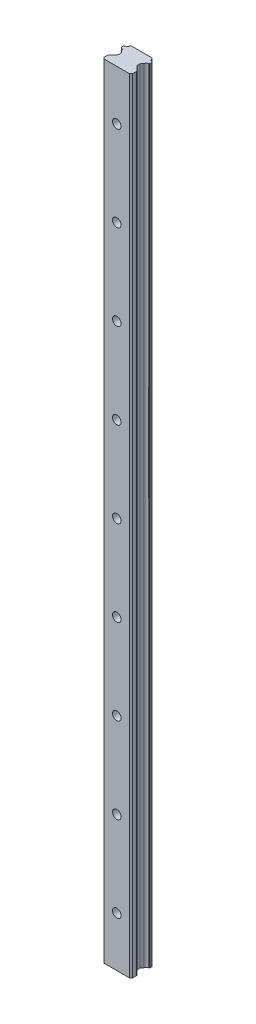
from build123d import *

# Parameters (mm, degrees)
EXTRUDE_1_DEPTH               = 550
SKETCH_80_R                   = 4.75
EXTRUDE_12_DEPTH              = 0.9
PATTERN_START                 = -17.499999985
PATTERN_LINEAR_1_OUTLINE_R    = 4.75
PATTERN_LINEAR_1_DEPTH        = 0.9
PATTERN_LINEAR_1_2_OUTLINE_R  = 4.75
PATTERN_LINEAR_1_2_DEPTH      = 0.9
PATTERN_LINEAR_1_3_OUTLINE_R  = 4.75
PATTERN_LINEAR_1_3_DEPTH      = 0.9
PATTERN_LINEAR_1_4_OUTLINE_R  = 4.75
PATTERN_LINEAR_1_4_DEPTH      = 0.9
PATTERN_LINEAR_1_5_OUTLINE_R  = 4.75
PATTERN_LINEAR_1_5_DEPTH      = 0.9
PATTERN_LINEAR_1_6_OUTLINE_R  = 4.75
PATTERN_LINEAR_1_6_DEPTH      = 0.9
PATTERN_LINEAR_1_7_OUTLINE_R  = 4.75
PATTERN_LINEAR_1_7_DEPTH      = 0.9
PATTERN_LINEAR_1_8_OUTLINE_R  = 4.75
PATTERN_LINEAR_1_8_DEPTH      = 0.9
PATTERN_LINEAR_1_9_OUTLINE_R  = 4.75
PATTERN_LINEAR_1_9_DEPTH      = 8.499999985
PATTERN_START_2               = -9
PATTERN_LINEAR_1_10_OUTLINE_R = 3
PATTERN_LINEAR_1_10_DEPTH     = 9


# Read off the part's stored shape, not the designer's step: Линейный массив1
with BuildPart() as part:
    # Эскиз1 → Бобышка-Вытянуть1 (new body)
    with BuildSketch(Plane(origin=(0, 0, 0), x_dir=(1, 0, 0), z_dir=(0, 1, 0))):
        with BuildLine():
            Line((-10, 3.656507036), (-10, 1))
            Line((-10, 1), (-9, 0))
            Line((-9, 0), (9, 0))
            Line((9, 0), (10, 1))
            Line((10, 1), (10, 3.656507036))
            ThreePointArc((10, 3.656507036), (9.92387953, 4.039190479), (9.707106773, 4.363613837))
            Line((9.707106773, 4.363613837), (6.892893227, 7.177827383))
            ThreePointArc((6.892893227, 7.177827383), (6.67612047, 7.502250741), (6.6, 7.884934184))
            Line((6.6, 7.884934184), (6.6, 9.445065806))
            ThreePointArc((6.6, 9.445065806), (6.67612047, 9.827749249), (6.892893227, 10.152172607))
            Line((6.892893227, 10.152172607), (7.63016236, 10.88944174))
            ThreePointArc((7.63016236, 10.88944174), (7.773916172, 11.035785914), (7.84680643, 11.2275378))
            ThreePointArc((7.84680643, 11.2275378), (8.39638832, 12.26292769), (9.431778202, 12.812509595))
            ThreePointArc((9.431778202, 12.812509595), (9.571493891, 12.861817755), (9.690625709, 12.949905089))
            Line((9.690625709, 12.949905089), (9.85355341, 13.11283279))
            ThreePointArc((9.85355341, 13.11283279), (9.961939771, 13.275044443), (10, 13.466386134))
            Line((10, 13.466386134), (10, 14.523613836))
            ThreePointArc((10, 14.523613836), (9.961939771, 14.714955527), (9.85355341, 14.87716718))
            Line((9.85355341, 14.87716718), (9.678500897, 15.052219693))
            ThreePointArc((9.678500897, 15.052219693), (9.560417661, 15.139748844), (9.421985093, 15.189159641))
            ThreePointArc((9.421985093, 15.189159641), (8.395921978, 15.736919382), (7.84816224, 16.7629825))
            ThreePointArc((7.84816224, 16.7629825), (7.775191486, 16.953000828), (7.632531165, 17.098189425))
            Line((7.632531165, 17.098189425), (7.230720605, 17.499999985))
            Line((7.230720605, 17.499999985), (-7.230720615, 17.499999985))
            Line((-7.230720615, 17.499999985), (-7.632531175, 17.098189425))
            ThreePointArc((-7.632531175, 17.098189425), (-7.775191503, 16.953000832), (-7.84816225, 16.7629825))
            ThreePointArc((-7.84816225, 16.7629825), (-8.395921997, 15.736919373), (-9.421985128, 15.189159636))
            ThreePointArc((-9.421985128, 15.189159636), (-9.560417671, 15.13974885), (-9.678500884, 15.052219716))
            Line((-9.678500884, 15.052219716), (-9.85355341, 14.87716719))
            ThreePointArc((-9.85355341, 14.87716719), (-9.961939771, 14.714955537), (-10, 14.523613846))
            Line((-10, 14.523613846), (-10, 13.466386134))
            ThreePointArc((-10, 13.466386134), (-9.961939771, 13.275044443), (-9.85355341, 13.11283279))
            Line((-9.85355341, 13.11283279), (-9.690625667, 12.949905047))
            ThreePointArc((-9.690625667, 12.949905047), (-9.57149389, 12.861817745), (-9.431778248, 12.812509604))
            ThreePointArc((-9.431778248, 12.812509604), (-8.396388337, 12.262927707), (-7.84680643, 11.2275378))
            ThreePointArc((-7.84680643, 11.2275378), (-7.773916168, 11.035785916), (-7.63016236, 10.88944174))
            Line((-7.63016236, 10.88944174), (-6.892893227, 10.152172607))
            ThreePointArc((-6.892893227, 10.152172607), (-6.67612047, 9.827749249), (-6.6, 9.445065806))
            Line((-6.6, 9.445065806), (-6.6, 7.884934184))
            ThreePointArc((-6.6, 7.884934184), (-6.67612047, 7.502250741), (-6.892893227, 7.177827383))
            Line((-6.892893227, 7.177827383), (-9.707106773, 4.363613837))
            ThreePointArc((-9.707106773, 4.363613837), (-9.92387953, 4.039190479), (-10, 3.656507036))
        make_face()
    extrude(amount=-EXTRUDE_1_DEPTH)

    # Эскиз6 → Вырез-Повернуть1 (revolve, cut)
    with BuildSketch(Plane(origin=(0, 30, 0), x_dir=(0, -1, 0), z_dir=(1, 0, 0)), mode=Mode.PRIVATE) as cut_revolve_1_sk:
        Polygon((60.25, 17.499999985), (65, 17.499999985), (65, 0), (62, 0), (62, 9), (60.25, 9), align=None)
    revolve(cut_revolve_1_sk.sketch.rotate(Axis((0, -35, -17.499999985), (0, 0, 1)), 270), axis=Axis((0, -35, -17.499999985), (0, 0, 1)), mode=Mode.SUBTRACT)

    # Pattern Linear 1 9 outline → Pattern Linear 1 9 (cut)
    with BuildSketch(Plane.XY.offset(PATTERN_START)):
        with Locations((0, -95)):
            Circle(PATTERN_LINEAR_1_9_OUTLINE_R)
        with Locations((0, -155)):
            Circle(PATTERN_LINEAR_1_9_OUTLINE_R)
        with Locations((0, -215)):
            Circle(PATTERN_LINEAR_1_9_OUTLINE_R)
        with Locations((0, -275)):
            Circle(PATTERN_LINEAR_1_9_OUTLINE_R)
        with Locations((0, -335)):
            Circle(PATTERN_LINEAR_1_9_OUTLINE_R)
        with Locations((0, -395)):
            Circle(PATTERN_LINEAR_1_9_OUTLINE_R)
        with Locations((0, -455)):
            Circle(PATTERN_LINEAR_1_9_OUTLINE_R)
        with Locations((0, -515)):
            Circle(PATTERN_LINEAR_1_9_OUTLINE_R)
    extrude(amount=PATTERN_LINEAR_1_9_DEPTH, mode=Mode.SUBTRACT)

    # Pattern Linear 1 10 outline → Pattern Linear 1 10 (cut)
    with BuildSketch(Plane.XY.offset(PATTERN_START_2)):
        with Locations((0, -95)):
            Circle(PATTERN_LINEAR_1_10_OUTLINE_R)
        with Locations((0, -155)):
            Circle(PATTERN_LINEAR_1_10_OUTLINE_R)
        with Locations((0, -215)):
            Circle(PATTERN_LINEAR_1_10_OUTLINE_R)
        with Locations((0, -275)):
            Circle(PATTERN_LINEAR_1_10_OUTLINE_R)
        with Locations((0, -335)):
            Circle(PATTERN_LINEAR_1_10_OUTLINE_R)
        with Locations((0, -395)):
            Circle(PATTERN_LINEAR_1_10_OUTLINE_R)
        with Locations((0, -455)):
            Circle(PATTERN_LINEAR_1_10_OUTLINE_R)
        with Locations((0, -515)):
            Circle(PATTERN_LINEAR_1_10_OUTLINE_R)
    extrude(amount=PATTERN_LINEAR_1_10_DEPTH, mode=Mode.SUBTRACT)


with BuildPart() as body_2:
    # Эскиз80 → Бобышка-Вытянуть12 (new body)
    with BuildSketch(Plane(origin=(0, 0, -17.499999985), x_dir=(-1, 0, 0), z_dir=(0, 0, -1))):
        with Locations((0, -35)):
            Circle(SKETCH_80_R)
    extrude(amount=-EXTRUDE_12_DEPTH)


with BuildPart() as body_3:
    # Линейный массив1 outline → Линейный массив1 (new body)
    with BuildSketch(Plane.XY.offset(PATTERN_START)):
        with Locations((0, -515)):
            Circle(PATTERN_LINEAR_1_OUTLINE_R)
    extrude(amount=PATTERN_LINEAR_1_DEPTH)


with BuildPart() as body_4:
    # Pattern Linear 1 2 outline → Pattern Linear 1 2 (new body)
    with BuildSketch(Plane.XY.offset(PATTERN_START)):
        with Locations((0, -455)):
            Circle(PATTERN_LINEAR_1_2_OUTLINE_R)
    extrude(amount=PATTERN_LINEAR_1_2_DEPTH)


with BuildPart() as body_5:
    # Pattern Linear 1 3 outline → Pattern Linear 1 3 (new body)
    with BuildSketch(Plane.XY.offset(PATTERN_START)):
        with Locations((0, -395)):
            Circle(PATTERN_LINEAR_1_3_OUTLINE_R)
    extrude(amount=PATTERN_LINEAR_1_3_DEPTH)


with BuildPart() as body_6:
    # Pattern Linear 1 4 outline → Pattern Linear 1 4 (new body)
    with BuildSketch(Plane.XY.offset(PATTERN_START)):
        with Locations((0, -335)):
            Circle(PATTERN_LINEAR_1_4_OUTLINE_R)
    extrude(amount=PATTERN_LINEAR_1_4_DEPTH)


with BuildPart() as body_7:
    # Pattern Linear 1 5 outline → Pattern Linear 1 5 (new body)
    with BuildSketch(Plane.XY.offset(PATTERN_START)):
        with Locations((0, -275)):
            Circle(PATTERN_LINEAR_1_5_OUTLINE_R)
    extrude(amount=PATTERN_LINEAR_1_5_DEPTH)


with BuildPart() as body_8:
    # Pattern Linear 1 6 outline → Pattern Linear 1 6 (new body)
    with BuildSketch(Plane.XY.offset(PATTERN_START)):
        with Locations((0, -215)):
            Circle(PATTERN_LINEAR_1_6_OUTLINE_R)
    extrude(amount=PATTERN_LINEAR_1_6_DEPTH)


with BuildPart() as body_9:
    # Pattern Linear 1 7 outline → Pattern Linear 1 7 (new body)
    with BuildSketch(Plane.XY.offset(PATTERN_START)):
        with Locations((0, -155)):
            Circle(PATTERN_LINEAR_1_7_OUTLINE_R)
    extrude(amount=PATTERN_LINEAR_1_7_DEPTH)


with BuildPart() as body_10:
    # Pattern Linear 1 8 outline → Pattern Linear 1 8 (new body)
    with BuildSketch(Plane.XY.offset(PATTERN_START)):
        with Locations((0, -95)):
            Circle(PATTERN_LINEAR_1_8_OUTLINE_R)
    extrude(amount=PATTERN_LINEAR_1_8_DEPTH)


solid = Compound([part.part, body_2.part, body_3.part, body_4.part, body_5.part, body_6.part, body_7.part, body_8.part, body_9.part, body_10.part])
